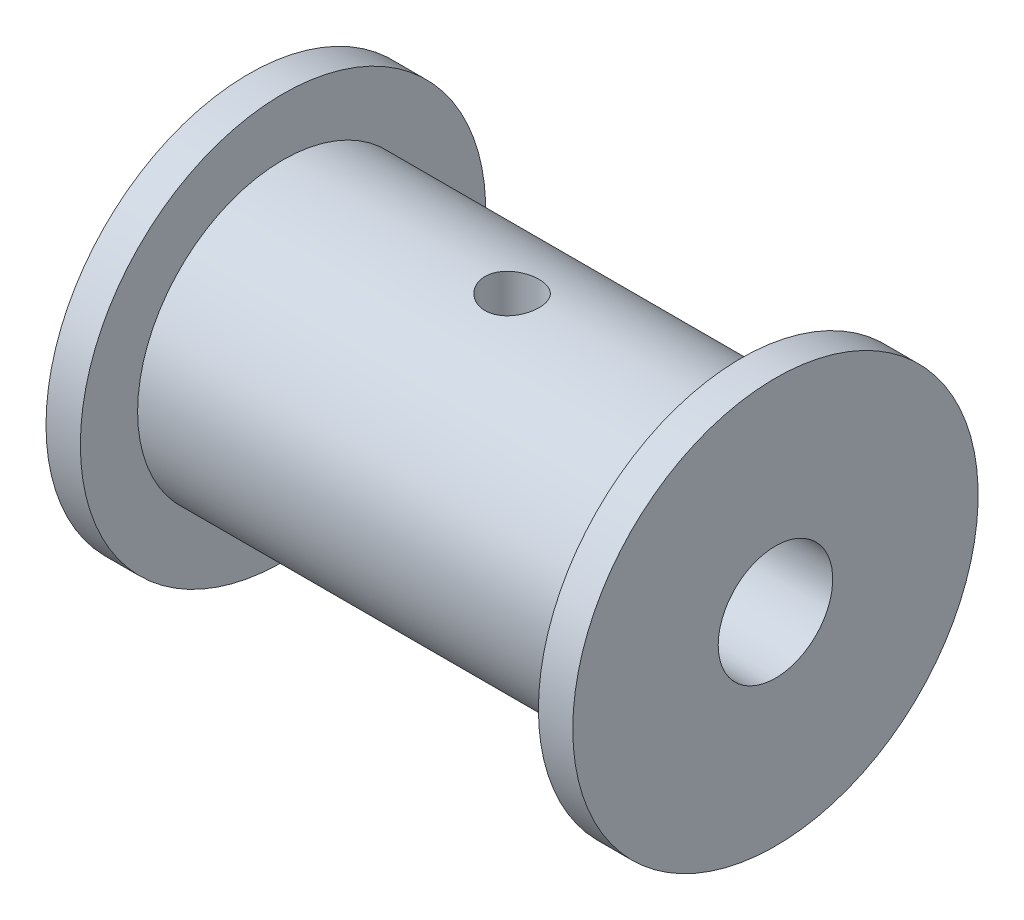
from build123d import *

# Parameters (mm, degrees)
SKETCH2_R          = 1.5
CUT_EXTRUDE1_DEPTH = 22.586077585


with BuildPart() as part:
    # Sketch1 → Revolve1 (revolve)
    with BuildSketch(Plane.XY):
        Polygon((14.605, 3.175), (14.605, 11.2395), (12.7, 11.2395), (12.7, 8.0645), (-12.7, 8.0645), (-12.7, 11.2395), (-14.605, 11.2395), (-14.605, 3.175), align=None)
    revolve(axis=Axis((-15.275524476, 0, 0), (1, 0, 0)))

    # Sketch2 → Cut-Extrude1 (cut, through all)
    with BuildSketch(Plane(origin=(0, 0, 0), x_dir=(1, 0, 0), z_dir=(0, 1, 0))):
        Circle(SKETCH2_R)
    extrude(amount=CUT_EXTRUDE1_DEPTH, mode=Mode.SUBTRACT)


solid = part.part
